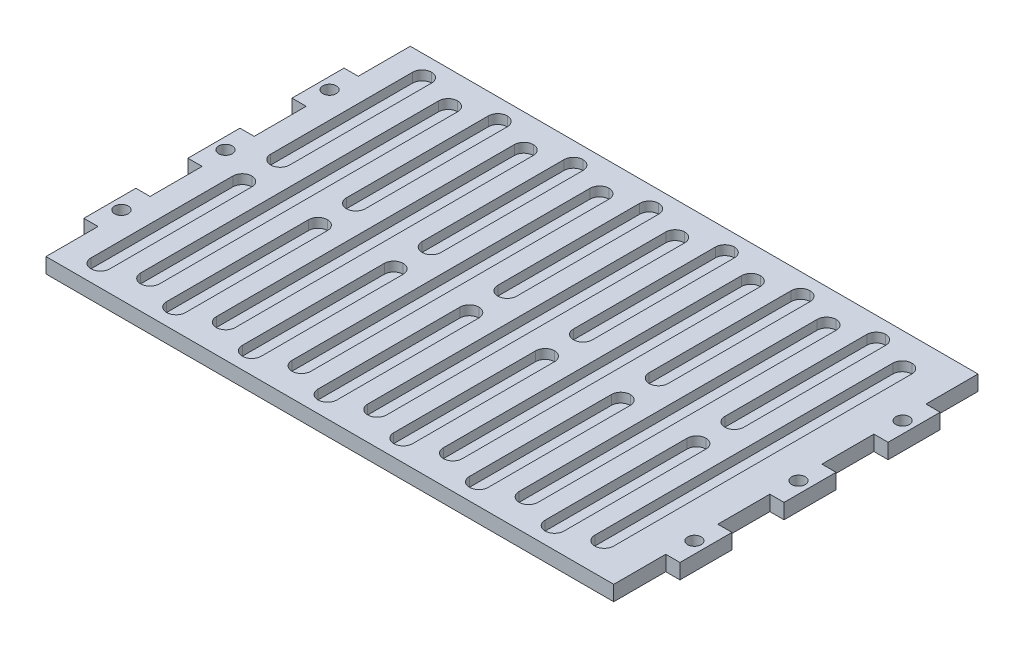
from build123d import *

# Parameters (mm, degrees)
SKETCH1_W               = 120
SKETCH1_H               = 77
BOSS_EXTRUDE1_DEPTH     = 3.2
SKETCH2_W               = 3
SKETCH2_H               = 11
BOSS_EXTRUDE2_DEPTH     = 3.2
LPATTERN1_COUNT         = 3
LPATTERN1_PITCH         = 22
MIRROR1_COPY_1_SKETCH_W = 3
MIRROR1_COPY_1_SKETCH_H = 11
MIRROR1_COPY_1_DEPTH    = 3.2
MIRROR1_COPY_2_SKETCH_W = 3
MIRROR1_COPY_2_SKETCH_H = 11
MIRROR1_COPY_2_DEPTH    = 3.2
SKETCH3_R               = 1.44
CUT_EXTRUDE1_DEPTH      = 74.901894428
LPATTERN2_COUNT         = 3
LPATTERN2_PITCH         = 22
MIRROR2_COPY_1_SKETCH_R = 1.44
MIRROR2_COPY_1_DEPTH    = 74.901894428
MIRROR2_COPY_2_SKETCH_R = 1.44
MIRROR2_COPY_2_DEPTH    = 74.901894428
SKETCH4_W               = 4
SKETCH4_H               = 34
SKETCH4_H_2             = 67
CUT_EXTRUDE2_DEPTH      = 2
FILLET1_R               = 2
LPATTERN3_COUNT         = 7
LPATTERN3_PITCH         = 16
FILLET1_OF_LPATTERN3_R  = 2


with BuildPart() as part:
    # Sketch1 → Boss-Extrude1 (new body)
    with BuildSketch(Plane(origin=(0, 0, 0), x_dir=(1, 0, 0), z_dir=(0, 1, 0))):
        Rectangle(SKETCH1_W, SKETCH1_H)
    extrude(amount=BOSS_EXTRUDE1_DEPTH)

    # Sketch2 → Boss-Extrude2 (add)
    with BuildSketch(Plane(origin=(0, 3.2, 0), x_dir=(1, 0, 0), z_dir=(0, 1, 0))):
        with Locations((-61.5, 22)):
            Rectangle(SKETCH2_W, SKETCH2_H)
    boss_extrude2 = extrude(amount=-BOSS_EXTRUDE2_DEPTH)

    # LPattern1: Boss-Extrude2 ×3
    with Locations(*[(0, 0, i * LPATTERN1_PITCH) for i in range(1, LPATTERN1_COUNT)]):
        add(boss_extrude2)

    # Mirror1: Boss-Extrude2 across plane
    add(boss_extrude2.mirror(Plane(origin=(0, 0, 0), x_dir=(0, 0, 1), z_dir=(1, 0, 0))))

    # Mirror1 copy 1 sketch → Mirror1 copy 1 (add)
    with BuildSketch(Plane(origin=(0, 3.2, 22), x_dir=(-1, 0, 0), z_dir=(0, 1, 0))):
        with Locations((-61.5, -22)):
            Rectangle(MIRROR1_COPY_1_SKETCH_W, MIRROR1_COPY_1_SKETCH_H)
    extrude(amount=-MIRROR1_COPY_1_DEPTH)

    # Mirror1 copy 2 sketch → Mirror1 copy 2 (add)
    with BuildSketch(Plane(origin=(0, 3.2, 44), x_dir=(-1, 0, 0), z_dir=(0, 1, 0))):
        with Locations((-61.5, -22)):
            Rectangle(MIRROR1_COPY_2_SKETCH_W, MIRROR1_COPY_2_SKETCH_H)
    extrude(amount=-MIRROR1_COPY_2_DEPTH)

    # Sketch3 → Cut-Extrude1 (cut, through all)
    with BuildSketch(Plane(origin=(0, 3.2, 0), x_dir=(1, 0, 0), z_dir=(0, 1, 0))):
        with Locations(Location((-60.56, 22, 0), (0, 0, 270))):
            Circle(SKETCH3_R)
    cut_extrude1 = extrude(amount=-CUT_EXTRUDE1_DEPTH, mode=Mode.SUBTRACT)

    # LPattern2: Cut-Extrude1 ×3
    with Locations(*[(0, 0, i * LPATTERN2_PITCH) for i in range(1, LPATTERN2_COUNT)]):
        add(cut_extrude1, mode=Mode.SUBTRACT)

    # Mirror2: Cut-Extrude1 across plane
    add(cut_extrude1.mirror(Plane(origin=(0, 0, 0), x_dir=(0, 0, 1), z_dir=(1, 0, 0))), mode=Mode.SUBTRACT)

    # Mirror2 copy 1 sketch → Mirror2 copy 1 (cut, through all)
    with BuildSketch(Plane(origin=(0, 3.2, 22), x_dir=(-1, 0, 0), z_dir=(0, 1, 0))):
        with Locations((-60.56, -22)):
            Circle(MIRROR2_COPY_1_SKETCH_R)
    extrude(amount=-MIRROR2_COPY_1_DEPTH, mode=Mode.SUBTRACT)

    # Mirror2 copy 2 sketch → Mirror2 copy 2 (cut, through all)
    with BuildSketch(Plane(origin=(0, 3.2, 44), x_dir=(-1, 0, 0), z_dir=(0, 1, 0))):
        with Locations((-60.56, -22)):
            Circle(MIRROR2_COPY_2_SKETCH_R)
    extrude(amount=-MIRROR2_COPY_2_DEPTH, mode=Mode.SUBTRACT)

    # Sketch4 → Cut-Extrude2 (cut)
    with BuildSketch(Plane(origin=(0, 3.2, 0), x_dir=(1, 0, 0), z_dir=(0, 1, 0))):
        with Locations((-53, 19)):
            Rectangle(SKETCH4_W, SKETCH4_H)
        with Locations((-45, 0)):
            Rectangle(SKETCH4_W, SKETCH4_H_2)
        with Locations((-53, -19)):
            Rectangle(SKETCH4_W, SKETCH4_H)
    cut_extrude2 = extrude(amount=-CUT_EXTRUDE2_DEPTH, mode=Mode.SUBTRACT)

    # Fillet1
    fillet1_edges = [part.edges().sort_by_distance(p)[0] for p in [
        (-47, 2.2, -33.5),
        (-55, 2.2, -36),
        (-51, 2.2, -36),
        (-43, 2.2, -33.5),
        (-55, 2.2, -2),
        (-51, 2.2, -2),
        (-55, 2.2, 2),
        (-51, 2.2, 2),
        (-51, 2.2, 36),
        (-55, 2.2, 36),
        (-47, 2.2, 33.5),
        (-43, 2.2, 33.5),
    ]]
    fillet(fillet1_edges, radius=FILLET1_R - 0.0001)  # a hair under: the kernel refuses the full size

    # LPattern3: Cut-Extrude2 ×7
    with Locations(*[(i * LPATTERN3_PITCH, 0, 0) for i in range(1, LPATTERN3_COUNT)]):
        add(cut_extrude2, mode=Mode.SUBTRACT)

    # Fillet1 of LPattern3
    fillet1_of_lpattern3_edges = [part.edges().sort_by_distance(p)[0] for p in [
        (-31, 2.2, -33.5),
        (-39, 2.2, -36),
        (-35, 2.2, -36),
        (-27, 2.2, -33.5),
        (-39, 2.2, -2),
        (-35, 2.2, -2),
        (-39, 2.2, 2),
        (-35, 2.2, 2),
        (-35, 2.2, 36),
        (-39, 2.2, 36),
        (-31, 2.2, 33.5),
        (-27, 2.2, 33.5),
        (-15, 2.2, -33.5),
        (-23, 2.2, -36),
        (-19, 2.2, -36),
        (-11, 2.2, -33.5),
        (-23, 2.2, -2),
        (-19, 2.2, -2),
        (-23, 2.2, 2),
        (-19, 2.2, 2),
        (-19, 2.2, 36),
        (-23, 2.2, 36),
        (-15, 2.2, 33.5),
        (-11, 2.2, 33.5),
        (1, 2.2, -33.5),
        (-7, 2.2, -36),
        (-3, 2.2, -36),
        (5, 2.2, -33.5),
        (-7, 2.2, -2),
        (-3, 2.2, -2),
        (-7, 2.2, 2),
        (-3, 2.2, 2),
        (-3, 2.2, 36),
        (-7, 2.2, 36),
        (1, 2.2, 33.5),
        (5, 2.2, 33.5),
        (17, 2.2, -33.5),
        (9, 2.2, -36),
        (13, 2.2, -36),
        (21, 2.2, -33.5),
        (9, 2.2, -2),
        (13, 2.2, -2),
        (9, 2.2, 2),
        (13, 2.2, 2),
        (13, 2.2, 36),
        (9, 2.2, 36),
        (17, 2.2, 33.5),
        (21, 2.2, 33.5),
        (33, 2.2, -33.5),
        (25, 2.2, -36),
        (29, 2.2, -36),
        (37, 2.2, -33.5),
        (25, 2.2, -2),
        (29, 2.2, -2),
        (25, 2.2, 2),
        (29, 2.2, 2),
        (29, 2.2, 36),
        (25, 2.2, 36),
        (33, 2.2, 33.5),
        (37, 2.2, 33.5),
        (49, 2.2, -33.5),
        (41, 2.2, -36),
        (45, 2.2, -36),
        (53, 2.2, -33.5),
        (41, 2.2, -2),
        (45, 2.2, -2),
        (41, 2.2, 2),
        (45, 2.2, 2),
        (45, 2.2, 36),
        (41, 2.2, 36),
        (49, 2.2, 33.5),
        (53, 2.2, 33.5),
    ]]
    fillet(fillet1_of_lpattern3_edges, radius=FILLET1_OF_LPATTERN3_R - 0.0001)  # a hair under: the kernel refuses the full size


solid = part.part
